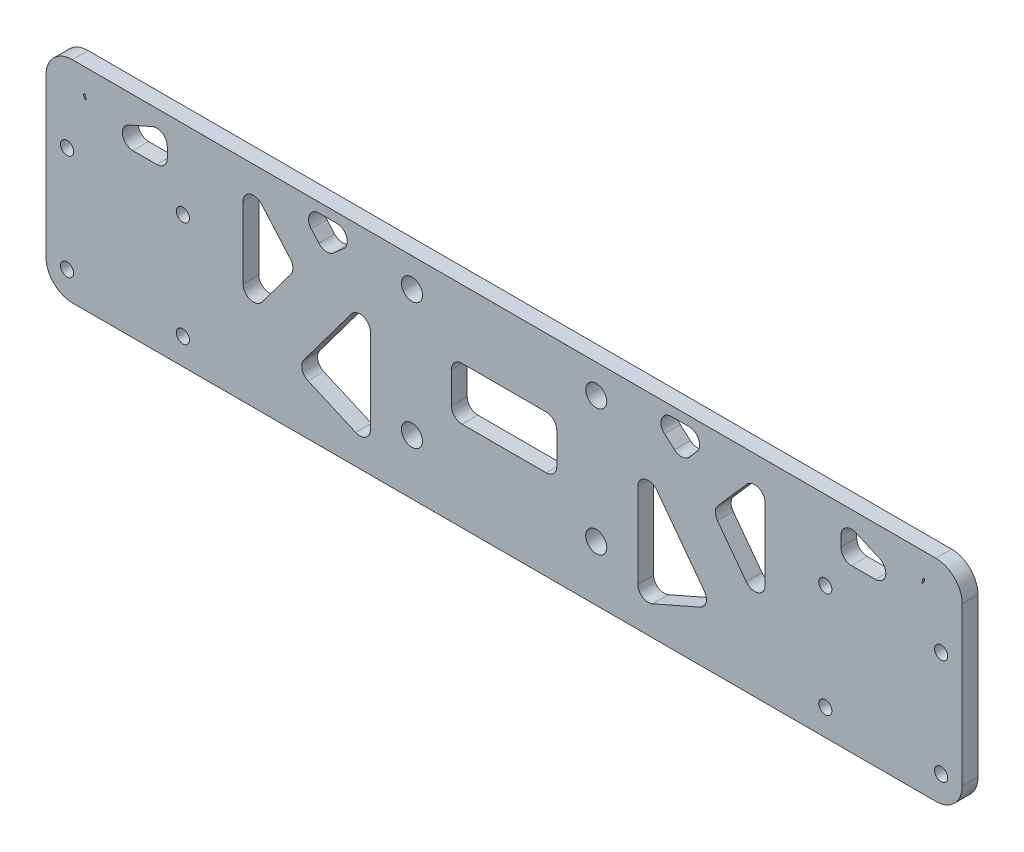
from build123d import *

# Parameters (mm, degrees)
SKETCH_1_W          = 174
SKETCH_1_H          = 45
SKETCH_1_R          = 2
EXTRUDE_1_DEPTH     = 3
SKETCH_2_R          = 1.25
CUT_EXTRUDE_1_DEPTH = 3
SKETCH_3_W          = 20
SKETCH_3_H          = 10
CUT_EXTRUDE_2_DEPTH = 4
FILLET_1_R          = 2
FILLET_2_R          = 5
SKETCH_4_W          = 93.235772227
SKETCH_4_H          = 5
CUT_EXTRUDE_3_DEPTH = 4
FILLET_3_R          = 5


with BuildPart() as part:
    # 草图1 → 凸台-拉伸1 (new body)
    with BuildSketch(Plane.XY):
        with Locations((87, -22.5)):
            Rectangle(SKETCH_1_W, SKETCH_1_H)
        with Locations((69.5, -10.5)):
            Circle(SKETCH_1_R, mode=Mode.SUBTRACT)
        with Locations(Location((104.5, -10.5, 0), (0, 0, 180))):
            Circle(SKETCH_1_R, mode=Mode.SUBTRACT)
        with Locations(Location((69.5, -34.5, 0), (0, 0, 180))):
            Circle(SKETCH_1_R, mode=Mode.SUBTRACT)
        with Locations((104.5, -34.5)):
            Circle(SKETCH_1_R, mode=Mode.SUBTRACT)
    extrude(amount=EXTRUDE_1_DEPTH)

    # 草图2 → 切除-拉伸1 (cut)
    with BuildSketch(Plane.XY.offset(3)):
        with Locations((148, -20)):
            Circle(SKETCH_2_R)
        with Locations((148, -40)):
            Circle(SKETCH_2_R)
        with Locations(Location((26, -40, 0), (0, 0, 180))):
            Circle(SKETCH_2_R)
        with Locations(Location((26, -20, 0), (0, 0, 180))):
            Circle(SKETCH_2_R)
        with Locations((4, -20)):
            Circle(SKETCH_2_R)
        with Locations((4, -40)):
            Circle(SKETCH_2_R)
        with Locations(Location((170, -40, 0), (0, 0, 180))):
            Circle(SKETCH_2_R)
        with Locations(Location((170, -20, 0), (0, 0, 180))):
            Circle(SKETCH_2_R)
    extrude(amount=-CUT_EXTRUDE_1_DEPTH, mode=Mode.SUBTRACT)

    # 草图3 → 切除-拉伸2 (cut)
    with BuildSketch(Plane.XY.offset(3)):
        Polygon((6.964585687, -8.446455347), (15.15178831, -8.446455347), (6.964585687, -12.03733369), align=None)
        Polygon((6.964585687, -14.220208877), (23.031657012, -7.17324777), (23.031657012, -14.220208877), align=None)
        Polygon((37.415694542, -6.798433242), (47.456920401, -18.258527972), (37.415694542, -31.683210371), align=None)
        Polygon((47.456920401, -6.798433242), (53.137279326, -13.281451581), (60.536376343, -6.798433242), align=None)
        Polygon((47.456920401, -34.411804354), (61.610874696, -15.488582851), (61.610874696, -40.632998636), align=None)
        Polygon((112.389125304, -40.632998636), (126.543079599, -34.411804354), (112.389125304, -15.488582851), align=None)
        Polygon((113.463623657, -6.798433242), (126.543079599, -6.798433242), (120.862720674, -13.281451581), align=None)
        Polygon((136.584305458, -31.683210371), (136.584305458, -6.798433242), (126.543079599, -18.258527972), align=None)
        Polygon((150.968342988, -14.220208877), (167.035414313, -14.220208877), (150.968342988, -7.17324777), align=None)
        Polygon((167.035414313, -12.03733369), (167.035414313, -8.446455347), (158.84821169, -8.446455347), align=None)
        with Locations((87, -22.950058647)):
            Rectangle(SKETCH_3_W, SKETCH_3_H)
    extrude(amount=-CUT_EXTRUDE_2_DEPTH, mode=Mode.SUBTRACT)

    # 圆角1
    # the kernel refuses this fillet: 2 mm, written as the material it adds along each edge
    with BuildSketch(Plane(origin=(15.15178831, -8.446455347, 3), x_dir=(-0.9157882087939493, -0.40166149508506527, 0), z_dir=(0, 0, -1)), Plane(origin=(167.035414313, -14.220208877, 3), x_dir=(-1, 0, 0), z_dir=(0, 0, -1))) as fillet_1_piece_1:
        with BuildLine():
            CenterArc((FILLET_1_R * 4.76965861114, FILLET_1_R), FILLET_1_R, 113.682087725, 156.317912275)
            Line((FILLET_1_R * 4.36799711605, FILLET_1_R * 1.91578820879), (0, 0))
            Line((0, 0), (FILLET_1_R * 4.76965861114, 0))
        make_face()
    extrude(amount=3)
    with BuildSketch(Plane(origin=(6.964585687, -12.03733369, 3), x_dir=(0.9157882087939492, 0.4016614950850657, 0), z_dir=(0, 0, -1)), Plane(origin=(167.035414313, -12.03733369, 3), x_dir=(0, 1, 0), z_dir=(0, 0, -1)), Plane(origin=(150.968342988, -7.17324777, 3), x_dir=(0, -1, 0), z_dir=(0, 0, -1))) as fillet_1_piece_2:
        with BuildLine():
            CenterArc((FILLET_1_R * 1.53055202243, -FILLET_1_R), FILLET_1_R, 90, 113.682087725)
            Line((FILLET_1_R * 0.614763813634, -FILLET_1_R * 1.40166149509), (0, 0))
            Line((0, 0), (FILLET_1_R * 1.53055202243, 0))
        make_face()
    extrude(amount=3)
    with BuildSketch(Plane(origin=(6.964585687, -8.446455347, 3), x_dir=(0, -1, 0), z_dir=(0, 0, -1)), Plane(origin=(77, -27.950058647, 3), x_dir=(1, 0, 0), z_dir=(0, 0, -1)), Plane(origin=(77, -17.950058647, 3), x_dir=(0, -1, 0), z_dir=(0, 0, -1)), Plane(origin=(97, -17.950058647, 3), x_dir=(-1, 0, 0), z_dir=(0, 0, -1)), Plane(origin=(120.862720674, -13.281451581, 3), x_dir=(0.6590115853993712, 0.752132787684068, 0), z_dir=(0, 0, -1)), Plane(origin=(150.968342988, -14.220208877, 3), x_dir=(1, 0, 0), z_dir=(0, 0, -1)), Plane(origin=(23.031657012, -14.220208877, 3), x_dir=(0, 1, 0), z_dir=(0, 0, -1))) as fillet_1_piece_3:
        with BuildLine():
            CenterArc((FILLET_1_R, -FILLET_1_R), FILLET_1_R, 90, 90)
            Line((0, -FILLET_1_R), (0, 0))
            Line((0, 0), (FILLET_1_R, 0))
        make_face()
    extrude(amount=3)
    with BuildSketch(Plane(origin=(97, -27.950058647, 3), x_dir=(-1, 0, 0), z_dir=(0, 0, -1)), Plane(origin=(167.035414313, -8.446455347, 3), x_dir=(0, -1, 0), z_dir=(0, 0, -1)), Plane(origin=(53.137279326, -13.281451581, 3), x_dir=(-0.6590115853993732, 0.7521327876840662, 0), z_dir=(0, 0, -1))) as fillet_1_piece_4:
        with BuildLine():
            CenterArc((FILLET_1_R, FILLET_1_R), FILLET_1_R, 180, 90)
            Line((0, FILLET_1_R), (0, 0))
            Line((0, 0), (FILLET_1_R, 0))
        make_face()
    extrude(amount=3)
    with BuildSketch(Plane(origin=(158.84821169, -8.446455347, 3), x_dir=(0.9157882087939491, -0.40166149508506555, 0), z_dir=(0, 0, -1)), Plane(origin=(6.964585687, -14.220208877, 3), x_dir=(1, 0, 0), z_dir=(0, 0, -1))) as fillet_1_piece_5:
        with BuildLine():
            CenterArc((FILLET_1_R * 4.76965861114, -FILLET_1_R), FILLET_1_R, 90, 156.317912275)
            Line((FILLET_1_R * 4.36799711605, -FILLET_1_R * 1.91578820879), (0, 0))
            Line((0, 0), (FILLET_1_R * 4.76965861114, 0))
        make_face()
    extrude(amount=3)
    with BuildSketch(Plane(origin=(126.543079599, -34.411804354, 3), x_dir=(-0.9154710305438037, -0.40238388664938624, 0), z_dir=(0, 0, -1))) as fillet_1_piece_6:
        with BuildLine():
            CenterArc((FILLET_1_R * 1.25870478162, FILLET_1_R), FILLET_1_R, 166.931997768, 103.068002232)
            Line((FILLET_1_R * 0.284602389093, FILLET_1_R * 1.22610733927), (0, 0))
            Line((0, 0), (FILLET_1_R * 1.25870478162, 0))
        make_face()
    extrude(amount=3)
    with BuildSketch(Plane(origin=(112.389125304, -40.632998636, 3), x_dir=(0.9154710305438044, 0.4023838866493844, 0), z_dir=(0, 0, -1)), Plane(origin=(61.610874696, -40.632998636, 3), x_dir=(0, 1, 0), z_dir=(0, 0, -1))) as fillet_1_piece_7:
        with BuildLine():
            CenterArc((FILLET_1_R * 1.53187139719, -FILLET_1_R), FILLET_1_R, 90, 113.727291576)
            Line((FILLET_1_R * 0.61640036665, -FILLET_1_R * 1.40238388665), (0, 0))
            Line((0, 0), (FILLET_1_R * 1.53187139719, 0))
        make_face()
    extrude(amount=3)
    with BuildSketch(Plane(origin=(112.389125304, -15.488582851, 3), x_dir=(0, -1, 0), z_dir=(0, 0, -1)), Plane(origin=(136.584305458, -31.683210371, 3), x_dir=(0, 1, 0), z_dir=(0, 0, -1)), Plane(origin=(37.415694542, -31.683210371, 3), x_dir=(0.5989578255907083, 0.8007805711701868, 0), z_dir=(0, 0, -1))) as fillet_1_piece_8:
        with BuildLine():
            CenterArc((FILLET_1_R * 3.00652315444, -FILLET_1_R), FILLET_1_R, 90, 143.204706192)
            Line((FILLET_1_R * 2.40756532885, -FILLET_1_R * 1.80078057117), (0, 0))
            Line((0, 0), (FILLET_1_R * 3.00652315444, 0))
        make_face()
    extrude(amount=3)
    with BuildSketch(Plane(origin=(126.543079599, -6.798433242, 3), x_dir=(-0.6590115853993721, -0.7521327876840671, 0), z_dir=(0, 0, -1))) as fillet_1_piece_9:
        with BuildLine():
            CenterArc((FILLET_1_R * 2.2057429387, FILLET_1_R), FILLET_1_R, 138.775465824, 131.224534176)
            Line((FILLET_1_R * 1.45361015102, FILLET_1_R * 1.6590115854), (0, 0))
            Line((0, 0), (FILLET_1_R * 2.2057429387, 0))
        make_face()
    extrude(amount=3)
    with BuildSketch(Plane(origin=(113.463623657, -6.798433242, 3), x_dir=(0.752132787684067, -0.6590115853993724, 0), z_dir=(0, 0, -1)), Plane(origin=(37.415694542, -6.798433242, 3), x_dir=(0, -1, 0), z_dir=(0, 0, -1)), Plane(origin=(60.536376343, -6.798433242, 3), x_dir=(-1, 0, 0), z_dir=(0, 0, -1))) as fillet_1_piece_10:
        with BuildLine():
            CenterArc((FILLET_1_R * 2.65872835395, -FILLET_1_R), FILLET_1_R, 90, 138.775465824)
            Line((FILLET_1_R * 1.99971676855, -FILLET_1_R * 1.75213278768), (0, 0))
            Line((0, 0), (FILLET_1_R * 2.65872835395, 0))
        make_face()
    extrude(amount=3)
    with BuildSketch(Plane(origin=(136.584305458, -6.798433242, 3), x_dir=(0, -1, 0), z_dir=(0, 0, -1))) as fillet_1_piece_11:
        with BuildLine():
            CenterArc((FILLET_1_R * 2.65872835395, FILLET_1_R), FILLET_1_R, 131.224534176, 138.775465824)
            Line((FILLET_1_R * 1.99971676855, FILLET_1_R * 1.75213278768), (0, 0))
            Line((0, 0), (FILLET_1_R * 2.65872835395, 0))
        make_face()
    extrude(amount=3)
    with BuildSketch(Plane(origin=(23.031657012, -7.17324777, 3), x_dir=(0, -1, 0), z_dir=(0, 0, -1))) as fillet_1_piece_12:
        with BuildLine():
            CenterArc((FILLET_1_R * 1.53055202243, FILLET_1_R), FILLET_1_R, 156.317912275, 113.682087725)
            Line((FILLET_1_R * 0.614763813634, FILLET_1_R * 1.40166149509), (0, 0))
            Line((0, 0), (FILLET_1_R * 1.53055202243, 0))
        make_face()
    extrude(amount=3)
    with BuildSketch(Plane(origin=(47.456920401, -18.258527972, 3), x_dir=(-0.5989578255907079, -0.8007805711701871, 0), z_dir=(0, 0, -1))) as fillet_1_piece_13:
        with BuildLine():
            CenterArc((FILLET_1_R * 0.810070570787, FILLET_1_R), FILLET_1_R, 191.980172016, 78.019827984)
            Line((-FILLET_1_R * 0.168148922043, FILLET_1_R * 0.792426822912), (0, 0))
            Line((0, 0), (FILLET_1_R * 0.810070570787, 0))
        make_face()
    extrude(amount=3)
    with BuildSketch(Plane(origin=(47.456920401, -6.798433242, 3), x_dir=(0.6590115853993722, -0.752132787684067, 0), z_dir=(0, 0, -1))) as fillet_1_piece_14:
        with BuildLine():
            CenterArc((FILLET_1_R * 2.2057429387, -FILLET_1_R), FILLET_1_R, 90, 131.224534176)
            Line((FILLET_1_R * 1.45361015102, -FILLET_1_R * 1.6590115854), (0, 0))
            Line((0, 0), (FILLET_1_R * 2.2057429387, 0))
        make_face()
    extrude(amount=3)
    with BuildSketch(Plane(origin=(61.610874696, -15.488582851, 3), x_dir=(0, -1, 0), z_dir=(0, 0, -1))) as fillet_1_piece_15:
        with BuildLine():
            CenterArc((FILLET_1_R * 3.00652315444, FILLET_1_R), FILLET_1_R, 126.795293808, 143.204706192)
            Line((FILLET_1_R * 2.40756532885, FILLET_1_R * 1.80078057117), (0, 0))
            Line((0, 0), (FILLET_1_R * 3.00652315444, 0))
        make_face()
    extrude(amount=3)
    with BuildSketch(Plane(origin=(47.456920401, -34.411804354, 3), x_dir=(0.9154710305438037, -0.40238388664938624, 0), z_dir=(0, 0, -1))) as fillet_1_piece_16:
        with BuildLine():
            CenterArc((FILLET_1_R * 1.25870478162, -FILLET_1_R), FILLET_1_R, 90, 103.068002232)
            Line((FILLET_1_R * 0.284602389093, -FILLET_1_R * 1.22610733927), (0, 0))
            Line((0, 0), (FILLET_1_R * 1.25870478162, 0))
        make_face()
    extrude(amount=3)
    with BuildSketch(Plane(origin=(126.543079599, -18.258527972, 3), x_dir=(0.5989578255907072, -0.8007805711701876, 0), z_dir=(0, 0, -1))) as fillet_1_piece_17:
        with BuildLine():
            CenterArc((FILLET_1_R * 0.810070570787, -FILLET_1_R), FILLET_1_R, 90, 78.019827984)
            Line((-FILLET_1_R * 0.168148922043, -FILLET_1_R * 0.792426822912), (0, 0))
            Line((0, 0), (FILLET_1_R * 0.810070570787, 0))
        make_face()
    extrude(amount=3)

    # 圆角2
    fillet_2_edges = [part.edges().sort_by_distance(p)[0] for p in [
        (0, 0, 1.5),
        (174, 0, 1.5),
        (174, -45, 1.5),
        (0, -45, 1.5),
    ]]
    fillet(fillet_2_edges, radius=FILLET_2_R)

    # 草图4 → 切除-拉伸3 (cut)
    with BuildSketch(Plane.XY.offset(3)):
        with Locations((127.382113887, -2.5)):
            Rectangle(SKETCH_4_W, SKETCH_4_H)
        with Locations((46.617886114, -2.5)):
            Rectangle(SKETCH_4_W, SKETCH_4_H)
    extrude(amount=-CUT_EXTRUDE_3_DEPTH, mode=Mode.SUBTRACT)

    # 圆角3
    fillet_3_edges = [part.edges().sort_by_distance(p)[0] for p in [
        (0, -5, 1.5),
        (174, -5, 1.5),
    ]]
    fillet(fillet_3_edges, radius=FILLET_3_R)


solid = part.part
